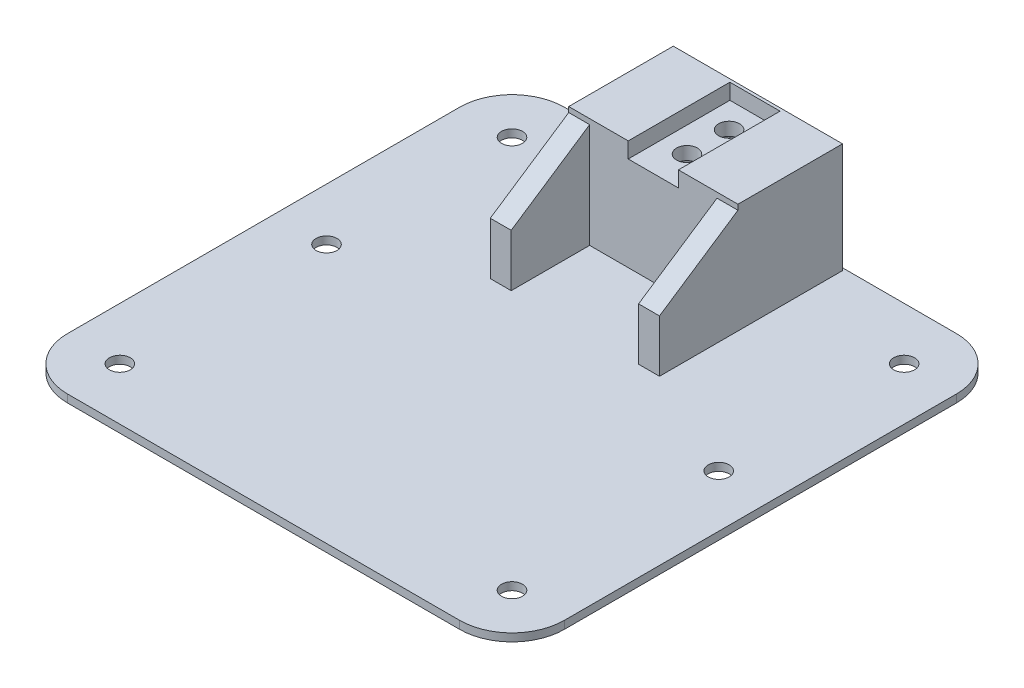
from build123d import *

# Parameters (mm, degrees)
EXTRUDE_1_DEPTH      = 1.5
SKETCH_2_W           = 32.36053695
SKETCH_2_H           = 20
EXTRUDE_2_DEPTH      = 18
SKETCH_3_W           = 3.3
SKETCH_3_H           = 0.56
SKETCH_3_W_2         = 0.5
SKETCH_3_W_3         = 1
EXTRUDE_4_DEPTH      = 3
SKETCH_6_W           = 4
SKETCH_6_H           = 15
EXTRUDE_7_DEPTH      = 20
CUT_EXTRUDE_START    = -4
CUT_EXTRUDE_3_DEPTH  = 4
CUT_EXTRUDE_4_DEPTH  = 4
SKETCH_12_R          = 1
CUT_EXTRUDE_9_DEPTH  = 71.381105419
SKETCH_14_R          = 1
CUT_EXTRUDE_10_DEPTH = 71.381105419
SKETCH_15_R          = 1
CUT_EXTRUDE_12_DEPTH = 71.381105419
SKETCH_16_W          = 9.556308291
SKETCH_16_H          = 18
CUT_EXTRUDE_13_DEPTH = 17
CUT_EXTRUDE_14_DEPTH = 161.738742996
SKETCH_18_R          = 2
CUT_EXTRUDE_15_DEPTH = 161.738742996


# Read off the part's stored shape, not the designer's step: 切除-拉伸3, 切除-拉伸4
with BuildPart() as part:
    # 草图1 → 凸台-拉伸1 (new body)
    with BuildSketch(Plane(origin=(0, 0, 104.816917971), x_dir=(1, 0, 0), z_dir=(0, 1, 0))):
        with BuildLine():
            Line((-37.5, -47.5), (37.5, -47.5))
            ThreePointArc((37.5, -47.5), (44.571067812, -44.571067812), (47.5, -37.5))
            Line((47.5, -37.5), (47.5, 37.5))
            ThreePointArc((47.5, 37.5), (44.571067812, 44.571067812), (37.5, 47.5))
            Line((37.5, 47.5), (-37.5, 47.5))
            ThreePointArc((-37.5, 47.5), (-44.571067812, 44.571067812), (-47.5, 37.5))
            Line((-47.5, 37.5), (-47.5, -37.5))
            ThreePointArc((-47.5, -37.5), (-44.571067812, -44.571067812), (-37.5, -47.5))
        make_face()
    extrude(amount=EXTRUDE_1_DEPTH)

    # 草图2 → 凸台-拉伸2 (add)
    with BuildSketch(Plane(origin=(0, 1.5, 104.816917971), x_dir=(1, 0, 0), z_dir=(0, 1, 0))):
        with Locations((0, 37.027280992)):
            Rectangle(SKETCH_2_W, SKETCH_2_H)
    extrude(amount=EXTRUDE_2_DEPTH)

    # 草图3 → 凸台-拉伸4 (add)
    with BuildSketch(Plane(origin=(0, 19.5, 62.644818489), x_dir=(1, 0, 0), z_dir=(0, 1, 0))):
        with Locations((2.15, 4.575181511)):
            Rectangle(SKETCH_3_W, SKETCH_3_H)
        with Locations((-2.15, 4.575181511)):
            Rectangle(SKETCH_3_W, SKETCH_3_H)
        with Locations((-0.25, 4.575181511)):
            Rectangle(SKETCH_3_W_2, SKETCH_3_H)
        with Locations((0.25, 4.575181511)):
            Rectangle(SKETCH_3_W_2, SKETCH_3_H)
        with Locations((4.3, 4.575181511)):
            Rectangle(SKETCH_3_W_3, SKETCH_3_H)
        with Locations((-4.3, 4.575181511)):
            Rectangle(SKETCH_3_W_3, SKETCH_3_H)
        Polygon((4.8, 4.295181511), (4.8, -15.144818489), (16.180268475, -15.144818489), (16.180268475, 4.855181511), (4.8, 4.855181511), align=None)
        Polygon((-4.8, -15.144818489), (-4.8, 4.295181511), (-4.8, 4.855181511), (-16.180268475, 4.855181511), (-16.180268475, -15.144818489), align=None)
    extrude(amount=EXTRUDE_4_DEPTH)

    # 草图6 → 凸台-拉伸7 (add)
    with BuildSketch(Plane(origin=(0, 1.5, 104.816917971), x_dir=(1, 0, 0), z_dir=(0, 1, 0))):
        with Locations((14.180268475, 19.527280992)):
            Rectangle(SKETCH_6_W, SKETCH_6_H)
        with Locations((-14.180268475, 19.527280992)):
            Rectangle(SKETCH_6_W, SKETCH_6_H)
    extrude(amount=EXTRUDE_7_DEPTH)

    # 切除-拉伸3 outline → 切除-拉伸3 (cut)
    with BuildSketch(Plane(origin=(16.180268475, 0, 62.644818489), x_dir=(0, 0, -1), z_dir=(1, 0, 0)).offset(CUT_EXTRUDE_START)):
        Polygon((-30.144818489, 21.5), (-30.144818489, 11.5), (-15.144818489, 21.5), align=None)
    extrude(amount=CUT_EXTRUDE_3_DEPTH, mode=Mode.SUBTRACT)

    # 切除-拉伸4 outline → 切除-拉伸4 (cut)
    with BuildSketch(Plane(origin=(-12.180268475, 0, 70.144818489), x_dir=(0, 0, -1), z_dir=(1, 0, 0)).offset(CUT_EXTRUDE_START)):
        Polygon((-22.644818489, 21.5), (-22.644818489, 11.5), (-7.644818489, 21.5), align=None)
    extrude(amount=CUT_EXTRUDE_4_DEPTH, mode=Mode.SUBTRACT)

    # 草图12 → 切除-拉伸9 (cut, through all)
    with BuildSketch(Plane(origin=(0, 1.5, 104.816917971), x_dir=(1, 0, 0), z_dir=(0, 1, 0))):
        with Locations(Location((-37.5, -37.5, 0), (0, 0, 270))):
            Circle(SKETCH_12_R)
        with Locations(Location((37.5, -37.5, 0), (0, 0, 270))):
            Circle(SKETCH_12_R)
        with Locations(Location((37.5, 37.5, 0), (0, 0, 270))):
            Circle(SKETCH_12_R)
    extrude(amount=-CUT_EXTRUDE_9_DEPTH, mode=Mode.SUBTRACT)

    # 草图14 → 切除-拉伸10 (cut, through all)
    with BuildSketch(Plane(origin=(0, 1.5, 104.816917971), x_dir=(1, 0, 0), z_dir=(0, 1, 0))):
        with Locations(Location((-37.5, 37.5, 0), (0, 0, 270))):
            Circle(SKETCH_14_R)
    extrude(amount=-CUT_EXTRUDE_10_DEPTH, mode=Mode.SUBTRACT)

    # 草图15 → 切除-拉伸12 (cut, through all)
    with BuildSketch(Plane(origin=(0, 1.5, 104.816917971), x_dir=(1, 0, 0), z_dir=(0, 1, 0))):
        with Locations(Location((-37.5, 2.027280992, 0), (0, 0, 270))):
            Circle(SKETCH_15_R)
        with Locations(Location((37.5, 2.027280992, 0), (0, 0, 270))):
            Circle(SKETCH_15_R)
    extrude(amount=-CUT_EXTRUDE_12_DEPTH, mode=Mode.SUBTRACT)

    # 草图16 → 切除-拉伸13 (cut)
    with BuildSketch(Plane(origin=(0, 0, 0), x_dir=(-1, 0, 0), z_dir=(0, -1, 0))):
        with Locations((-0.021845855, -67.349636979)):
            Rectangle(SKETCH_16_W, SKETCH_16_H)
    extrude(amount=-CUT_EXTRUDE_13_DEPTH, mode=Mode.SUBTRACT)

    # 草图17 → 切除-拉伸14 (cut, through all)
    with BuildSketch(Plane(origin=(0, 19.5, 0), x_dir=(1, 0, 0), z_dir=(0, 1, 0))):
        with BuildLine():
            ThreePointArc((0, -70.3523833), (-1, -71.3523833), (0, -72.3523833))
            Line((0, -72.3523833), (0, -71.3523833))
            Line((0, -71.3523833), (0, -70.3523833))
        make_face()
        with BuildLine():
            Line((0, -71.3523833), (0, -72.3523833))
            ThreePointArc((0, -72.3523833), (0.707106781, -72.059490081), (1, -71.3523833))
            ThreePointArc((1, -71.3523833), (0.707106781, -70.645276519), (0, -70.3523833))
            Line((0, -70.3523833), (0, -71.3523833))
        make_face()
        with BuildLine():
            ThreePointArc((0, -62.303923017), (-1, -63.303923017), (0, -64.303923017))
            Line((0, -64.303923017), (0, -63.303923017))
            Line((0, -63.303923017), (0, -62.303923017))
        make_face()
        with BuildLine():
            Line((0, -63.303923017), (0, -64.303923017))
            ThreePointArc((0, -64.303923017), (0.707106781, -64.011029798), (1, -63.303923017))
            ThreePointArc((1, -63.303923017), (0.707106781, -62.596816236), (0, -62.303923017))
            Line((0, -62.303923017), (0, -63.303923017))
        make_face()
    extrude(amount=-CUT_EXTRUDE_14_DEPTH, mode=Mode.SUBTRACT)

    # 草图18 → 切除-拉伸15 (cut, through all)
    with BuildSketch(Plane(origin=(0, 19.5, 0), x_dir=(1, 0, 0), z_dir=(0, 1, 0))):
        with Locations(Location((0, -63.303923017, 0), (0, 0, 270))):
            Circle(SKETCH_18_R)
        with Locations(Location((0, -71.3523833, 0), (0, 0, 270))):
            Circle(SKETCH_18_R)
        with Locations(Location((-37.5, -67.316917971, 0), (0, 0, 270))):
            Circle(SKETCH_18_R)
        with Locations(Location((37.5, -67.316917971, 0), (0, 0, 270))):
            Circle(SKETCH_18_R)
        with Locations(Location((37.5, -102.789636979, 0), (0, 0, 270))):
            Circle(SKETCH_18_R)
        with Locations(Location((-37.5, -102.789636979, 0), (0, 0, 270))):
            Circle(SKETCH_18_R)
        with Locations(Location((-37.5, -142.316917971, 0), (0, 0, 270))):
            Circle(SKETCH_18_R)
        with Locations(Location((37.5, -142.316917971, 0), (0, 0, 270))):
            Circle(SKETCH_18_R)
    extrude(amount=-CUT_EXTRUDE_15_DEPTH, mode=Mode.SUBTRACT)


solid = part.part
